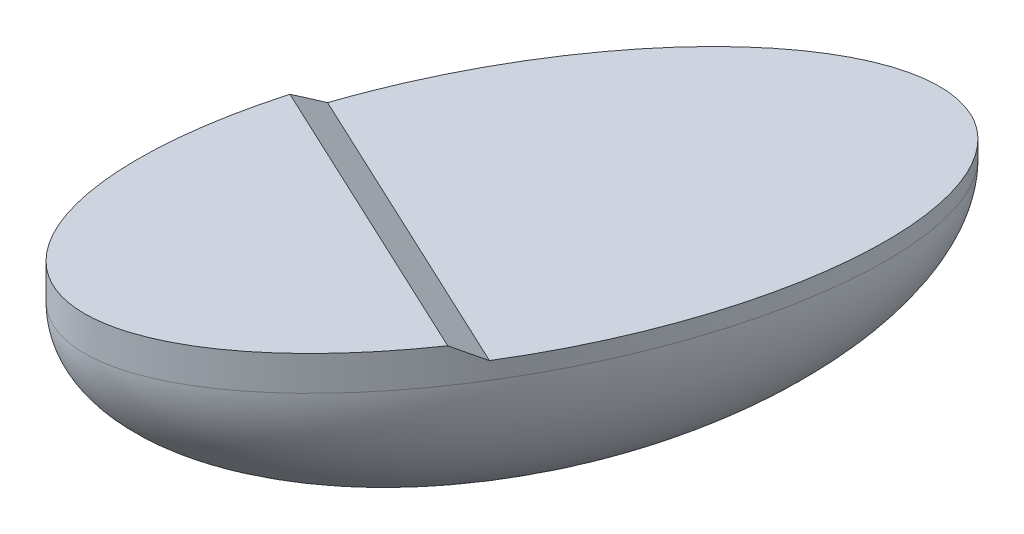
from build123d import *

# Parameters (mm, degrees)
SKETCH1_RX          = 40000
SKETCH1_RY          = 20000
BOSS_EXTRUDE1_DEPTH = 2000
REVOLVE1_ANGLE      = 180
BOSS_EXTRUDE2_DEPTH = 2000
CHAMFER1_SIZE2      = 3464.101615138
CHAMFER1_SIZE       = 2000


with BuildPart() as part:
    # Sketch1 → Boss-Extrude1 (new body)
    with BuildSketch(Plane(origin=(0, 0, 0), x_dir=(1, 0, 0), z_dir=(0, 1, 0))):
        with Locations(Location((0, 0), (0, 0, 64.916405994))):
            Ellipse(SKETCH1_RX, SKETCH1_RY)
    extrude(amount=BOSS_EXTRUDE1_DEPTH)

    # Sketch2 → Revolve1 (revolve)
    with BuildSketch(Plane.XZ):
        with BuildLine():
            Line((-16957.604241945, 36227.609062338), (16957.604241945, -36227.609062338))
            add(Edge.make_bspline(
                [(16957.604241945, -36227.609062338), (35071.408773114, -27748.806941365), (18113.804531169, 8478.802120973), (1156.200289224, 44706.41118331), (-16957.604241945, 36227.609062338)],
                knots=[0, 0, 0, 1.570796327, 1.570796327, 3.141592654, 3.141592654, 3.141592654], degree=2, weights=[1, 0.707106781, 1, 0.707106781, 1]))
        make_face()
    revolve(axis=Axis((-16957.604241945, 0, 36227.609062338), (0.42394010604863064, 0, -0.9056902265584387)), revolution_arc=REVOLVE1_ANGLE)

    # Sketch3 → Boss-Extrude2 (add)
    with BuildSketch(Plane(origin=(0, 2000, 0), x_dir=(1, 0, 0), z_dir=(0, 1, 0))):
        with BuildLine():
            add(Edge.make_bspline(
                [(-21472.680239623, 86.630430683), (-31355.87407629, -29487.993395197), (-16957.604241945, -36227.609062338)],
                knots=[1.79837239, 1.79837239, 1.79837239, 3.141592654, 3.141592654, 3.141592654], degree=2, weights=[1, 0.782820781, 1]))
            add(Edge.make_bspline(
                [(-16957.604241945, -36227.609062338), (-2559.334407601, -42967.224729478), (13820.841122912, -16433.74127093)],
                knots=[3.141592654, 3.141592654, 3.141592654, 4.484812917, 4.484812917, 4.484812917], degree=2, weights=[1, 0.782820781, 1]))
            Line((13820.841122912, -16433.74127093), (-21472.680239623, 86.630430683))
        make_face()
    extrude(amount=BOSS_EXTRUDE2_DEPTH)

    # Chamfer1
    chamfer1_edges = [part.edges().sort_by_distance(p)[0] for p in [
        (-3825.919558356, 4000, 8173.555420123),
    ]]
    chamfer1_side = [part.faces().sort_by_distance(p)[0] for p in [
        (-3825.919558356, 3960, 8173.555420123),
    ]]
    chamfer(chamfer1_edges, length=CHAMFER1_SIZE - 0.0001, length2=CHAMFER1_SIZE2 - 0.0001, reference=chamfer1_side[0])  # a hair under: the kernel refuses the full size


solid = part.part
